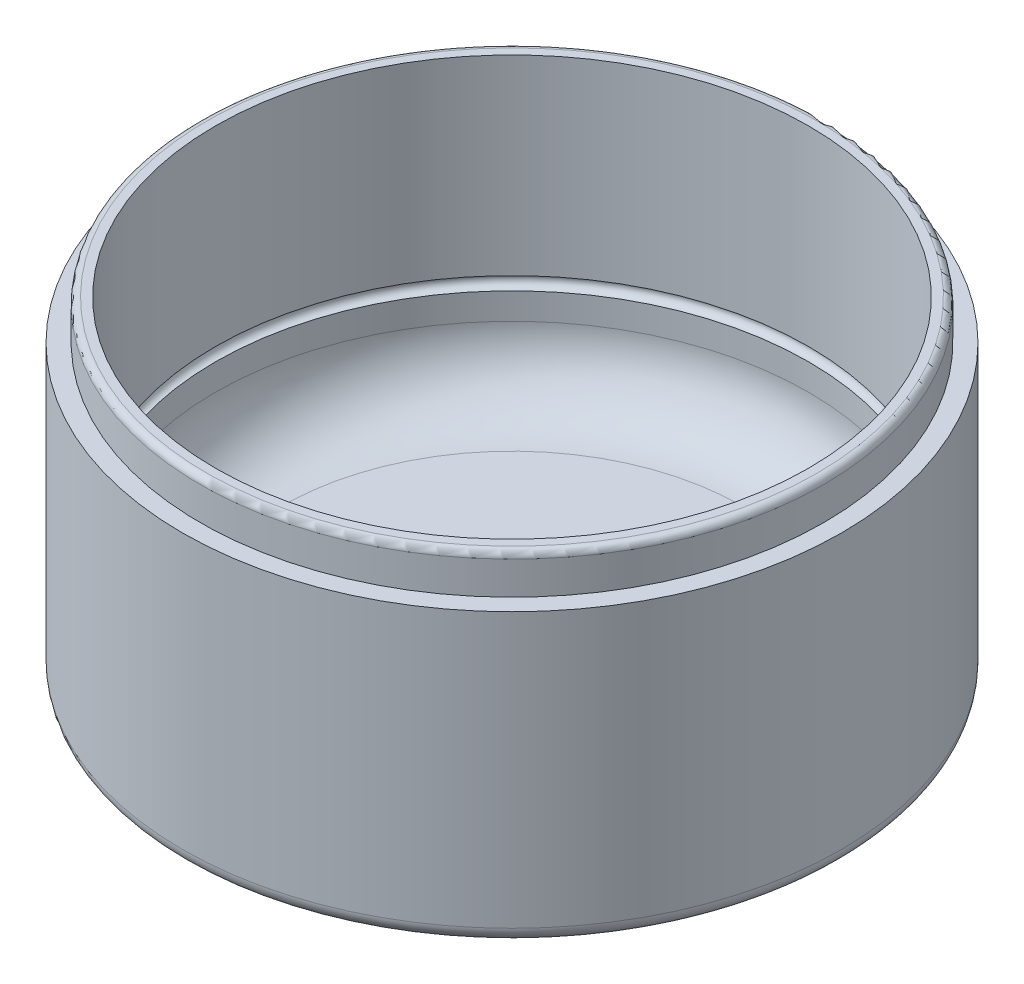
from build123d import *

# Parameters (mm, degrees)
SKETCH1_R           = 50
BOSS_EXTRUDE1_DEPTH = 50
SHELL2_T            = -5
SKETCH3_W           = 2.7
SKETCH3_H           = 6
FILLET1_R           = 1
FILLET2_R           = 10
FILLET3_R           = 2.4
SKETCH6_R           = 1


with BuildPart() as part:
    # Sketch1 → Boss-Extrude1 (new body)
    with BuildSketch(Plane(origin=(0, 0, 0), x_dir=(1, 0, 0), z_dir=(0, 1, 0))):
        Circle(SKETCH1_R)
    extrude(amount=-BOSS_EXTRUDE1_DEPTH)

    # Shell2
    shell2_openings = [part.faces().sort_by_distance(p)[0] for p in [
        (0, 0, 0),
    ]]
    offset(amount=SHELL2_T, openings=shell2_openings, kind=Kind.INTERSECTION)

    # Cut-Sweep1: sweep along a path in Sketch4
    with BuildLine(Plane(origin=(0, 0, 0), x_dir=(1, 0, 0), z_dir=(0, 1, 0))) as cut_sweep1_path:
        CenterArc((0, 0), 47.6, 0, 360)
    # Sketch3 → Cut-Sweep1 (sweep, cut)
    with BuildSketch(Plane.XY):
        with Locations((48.65, -3)):
            Rectangle(SKETCH3_W, SKETCH3_H)
    sweep(path=cut_sweep1_path.line, mode=Mode.SUBTRACT)

    # Fillet1
    fillet1_edges = [part.edges().sort_by_distance(p)[0] for p in [
        (-47.3, 0, 0),
    ]]
    fillet(fillet1_edges, radius=FILLET1_R)

    # Fillet2
    fillet2_edges = [part.edges().sort_by_distance(p)[0] for p in [
        (-45, -45, 0),
    ]]
    fillet(fillet2_edges, radius=FILLET2_R)

    # Fillet3
    fillet3_edges = [part.edges().sort_by_distance(p)[0] for p in [
        (-50, -50, 0),
    ]]
    fillet(fillet3_edges, radius=FILLET3_R)

    # Cut-Sweep2: sweep along a path in Sketch5
    with BuildLine(Plane(origin=(0, -30, 0), x_dir=(1, 0, 0), z_dir=(0, 1, 0))) as cut_sweep2_path:
        CenterArc((0, 0), 45, 0, 360)
    # Sketch6 → Cut-Sweep2 (sweep, cut)
    with BuildSketch(Plane.XY):
        with Locations((45, -30)):
            Circle(SKETCH6_R)
    sweep(path=cut_sweep2_path.line, mode=Mode.SUBTRACT)


solid = part.part
